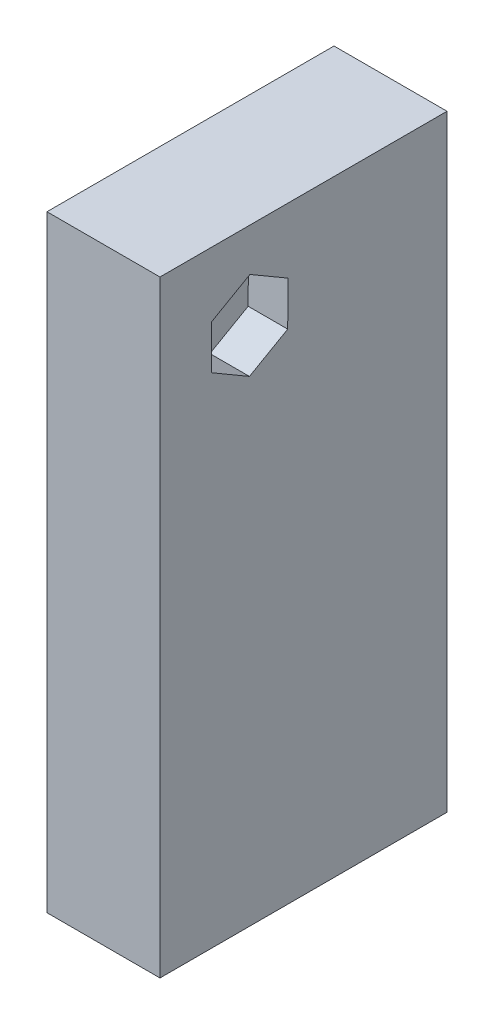
from build123d import *

# Parameters (mm, degrees)
SKETCH1_W           = 20
SKETCH1_H           = 107.436707244
BOSS_EXTRUDE1_DEPTH = 50.8
CUT_EXTRUDE2_DEPTH  = 7
CUT_EXTRUDE3_DEPTH  = 7


with BuildPart() as part:
    # Sketch1 → Boss-Extrude1 (new body)
    with BuildSketch(Plane.XY):
        with Locations((94.748429341, -80.835326077)):
            Rectangle(SKETCH1_W, SKETCH1_H)
    extrude(amount=-BOSS_EXTRUDE1_DEPTH)

    # Sketch3 → Cut-Extrude2 (cut)
    with BuildSketch(Plane.ZY.offset(-84.748429341)):
        Polygon((-9.144783688, -38.547498147), (-15.914394935, -34.684550624), (-22.644611247, -38.615732175), (-22.605216312, -46.40986125), (-15.835605065, -50.272808774), (-9.105388753, -46.341627222), align=None)
    extrude(amount=-CUT_EXTRUDE2_DEPTH, mode=Mode.SUBTRACT)

    # Sketch4 → Cut-Extrude3 (cut)
    with BuildSketch(Plane(origin=(104.748429341, 0, 0), x_dir=(0, 0, -1), z_dir=(1, 0, 0))):
        Polygon((15.835605065, -50.272808774), (9.105388753, -46.341627222), (9.144783688, -38.547498147), (15.914394935, -34.684550624), (22.644611247, -38.615732175), (22.605216312, -46.40986125), align=None)
    extrude(amount=-CUT_EXTRUDE3_DEPTH, mode=Mode.SUBTRACT)


solid = part.part
